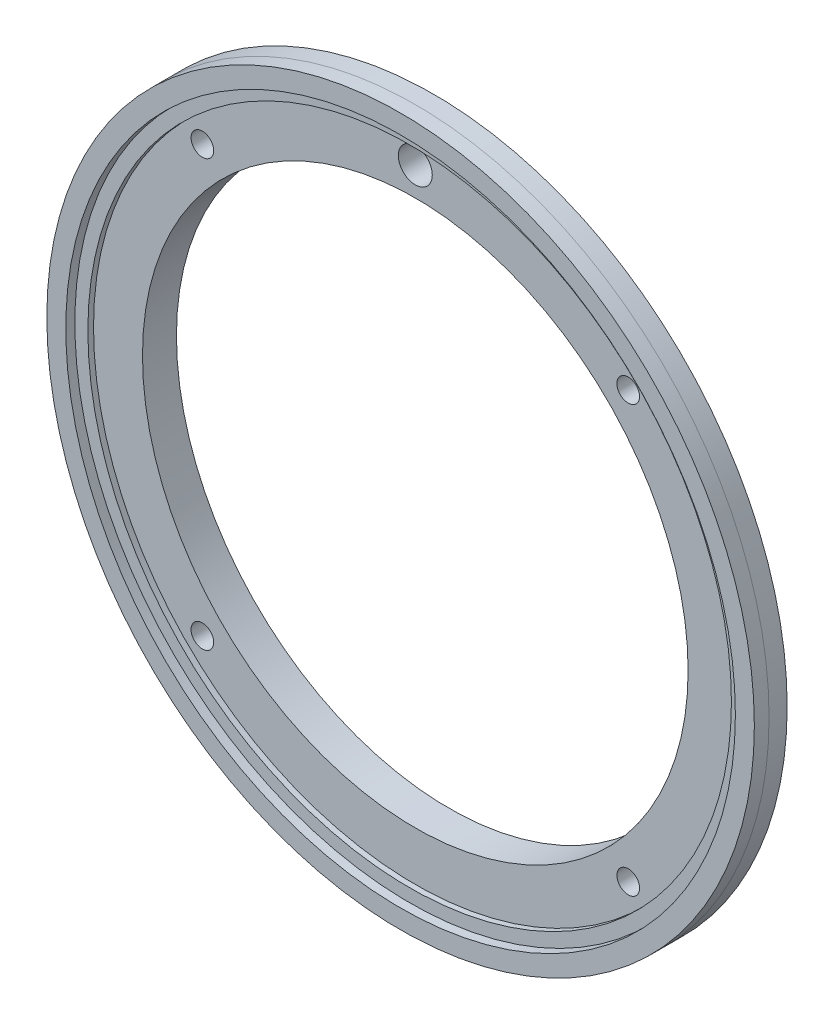
from build123d import *

# Parameters (mm, degrees)
SKETCH1_R            = 28.3
SKETCH1_R_2          = 24.1
BOSS_EXTRUDE1_DEPTH  = 0.6
SKETCH2_R            = 29.4
SKETCH2_R_2          = 24.1
BOSS_EXTRUDE2_DEPTH  = 0.8
SKETCH3_R            = 31.25
SKETCH3_R_2          = 24.1
BOSS_EXTRUDE3_DEPTH  = 1.6
SKETCH4_R            = 31.25
SKETCH4_R_2          = 28.425
BOSS_EXTRUDE4_DEPTH  = 0.5
SKETCH5_R            = 31.25
SKETCH5_R_2          = 29.575
BOSS_EXTRUDE5_DEPTH  = 0.8
SKETCH6_R            = 1
SKETCH6_R_2          = 1.5
CUT_EXTRUDE1_DEPTH   = 45.402871529
CUT_EXTRUDE2_DEPTH   = 0.6
SPLIT1_START         = 3
SPLIT1_OUTLINE_R     = 31.25
SPLIT1_OUTLINE_R_2   = 28.425
SPLIT1_DEPTH         = 1.3
SPLIT1_2_OUTLINE_R   = 31.25
SPLIT1_2_OUTLINE_R_2 = 29.575
SPLIT1_2_DEPTH       = 1.3
SPLIT1_3_OUTLINE_R   = 29.575
SPLIT1_3_OUTLINE_R_2 = 28.425
SPLIT1_3_DEPTH       = 0.5


# Read off the part's stored shape, not the designer's step: Split1
with BuildPart() as part:
    # Sketch1 → Boss-Extrude1 (new body)
    with BuildSketch(Plane.XY):
        Circle(SKETCH1_R)
        Circle(SKETCH1_R_2, mode=Mode.SUBTRACT)
    extrude(amount=BOSS_EXTRUDE1_DEPTH)

    # Sketch2 → Boss-Extrude2 (add)
    with BuildSketch(Plane.XY.offset(0.6)):
        with Locations(Location((0, 0, 0), (0, 0, 180))):
            Circle(SKETCH2_R)
        Circle(SKETCH2_R_2, mode=Mode.SUBTRACT)
    extrude(amount=BOSS_EXTRUDE2_DEPTH)

    # Sketch3 → Boss-Extrude3 (add)
    with BuildSketch(Plane.XY.offset(1.4)):
        Circle(SKETCH3_R)
        Circle(SKETCH3_R_2, mode=Mode.SUBTRACT)
    extrude(amount=BOSS_EXTRUDE3_DEPTH)

    # Sketch4 → Boss-Extrude4 (add)
    with BuildSketch(Plane.XY.offset(3)):
        Circle(SKETCH4_R)
        Circle(SKETCH4_R_2, mode=Mode.SUBTRACT)
    extrude(amount=BOSS_EXTRUDE4_DEPTH)

    # Sketch5 → Boss-Extrude5 (add)
    with BuildSketch(Plane.XY.offset(3.5)):
        Circle(SKETCH5_R)
        Circle(SKETCH5_R_2, mode=Mode.SUBTRACT)
    extrude(amount=BOSS_EXTRUDE5_DEPTH)

    # Sketch6 → Cut-Extrude1 (cut, through all)
    with BuildSketch(Plane(origin=(0, 0, 0), x_dir=(-1, 0, 0), z_dir=(0, 0, -1))):
        with Locations((18.80904038, 18.80904038)):
            Circle(SKETCH6_R)
        with Locations((18.80904038, -18.80904038)):
            Circle(SKETCH6_R)
        with Locations((-18.80904038, -18.80904038)):
            Circle(SKETCH6_R)
        with Locations((-18.80904038, 18.80904038)):
            Circle(SKETCH6_R)
        with Locations((0, 26.6)):
            Circle(SKETCH6_R_2)
    extrude(amount=-CUT_EXTRUDE1_DEPTH, mode=Mode.SUBTRACT)

    # Sketch7 → Cut-Extrude2 (cut)
    with BuildSketch(Plane(origin=(0, 0, 0), x_dir=(-1, 0, 0), z_dir=(0, 0, -1))):
        with BuildLine():
            Line((-1.5, 28.260219391), (-1.5, 26.6))
            ThreePointArc((-1.5, 26.6), (0, 28.1), (1.5, 26.6))
            Line((1.5, 26.6), (1.5, 28.260219391))
            ThreePointArc((1.5, 28.260219391), (0, 28.3), (-1.5, 28.260219391))
        make_face()
    extrude(amount=-CUT_EXTRUDE2_DEPTH, mode=Mode.SUBTRACT)

    # Split1 outline → Split1 (cut)
    with BuildSketch(Plane.XY.offset(SPLIT1_START)):
        Circle(SPLIT1_OUTLINE_R)
        Circle(SPLIT1_OUTLINE_R_2, mode=Mode.SUBTRACT)
    extrude(amount=SPLIT1_DEPTH, mode=Mode.SUBTRACT)


with BuildPart() as body_2:
    # Split1 2 outline → Split1 2 (new body)
    with BuildSketch(Plane.XY.offset(SPLIT1_START)):
        Circle(SPLIT1_2_OUTLINE_R)
        Circle(SPLIT1_2_OUTLINE_R_2, mode=Mode.SUBTRACT)
    extrude(amount=SPLIT1_2_DEPTH)

    # Split1 3 outline → Split1 3 (add)
    with BuildSketch(Plane.XY.offset(SPLIT1_START)):
        Circle(SPLIT1_3_OUTLINE_R)
        Circle(SPLIT1_3_OUTLINE_R_2, mode=Mode.SUBTRACT)
    extrude(amount=SPLIT1_3_DEPTH)


solid = Compound([part.part, body_2.part])
